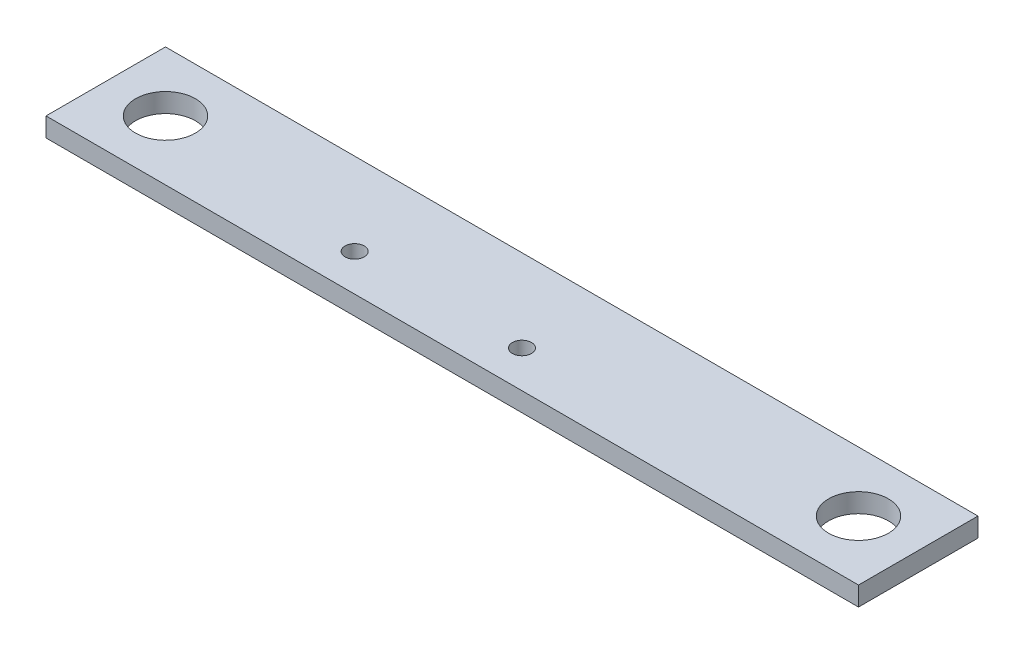
from build123d import *

# Parameters (mm, degrees)
SKETCH1_W           = 170
SKETCH1_H           = 25
SKETCH1_R           = 2
SKETCH1_R_2         = 6.25
BOSS_EXTRUDE1_DEPTH = 4
SKETCH2_R           = 6.25
CUT_EXTRUDE1_DEPTH  = 87.007267135


with BuildPart() as part:
    # Sketch1 → Boss-Extrude1 (new body)
    with BuildSketch(Plane(origin=(0, 0, 0), x_dir=(1, 0, 0), z_dir=(0, 1, 0))):
        Rectangle(SKETCH1_W, SKETCH1_H)
        with Locations((-28.158485727, -4.763382536)):
            Circle(SKETCH1_R, mode=Mode.SUBTRACT)
        with Locations((6.841514273, -4.763382536)):
            Circle(SKETCH1_R, mode=Mode.SUBTRACT)
        with Locations((72.5, 0)):
            Circle(SKETCH1_R_2, mode=Mode.SUBTRACT)
    extrude(amount=BOSS_EXTRUDE1_DEPTH)

    # Sketch2 → Cut-Extrude1 (cut, through all)
    with BuildSketch(Plane(origin=(0, 4, 0), x_dir=(1, 0, 0), z_dir=(0, 1, 0))):
        with Locations((-72.5, 0)):
            Circle(SKETCH2_R)
    extrude(amount=-CUT_EXTRUDE1_DEPTH, mode=Mode.SUBTRACT)


solid = part.part
